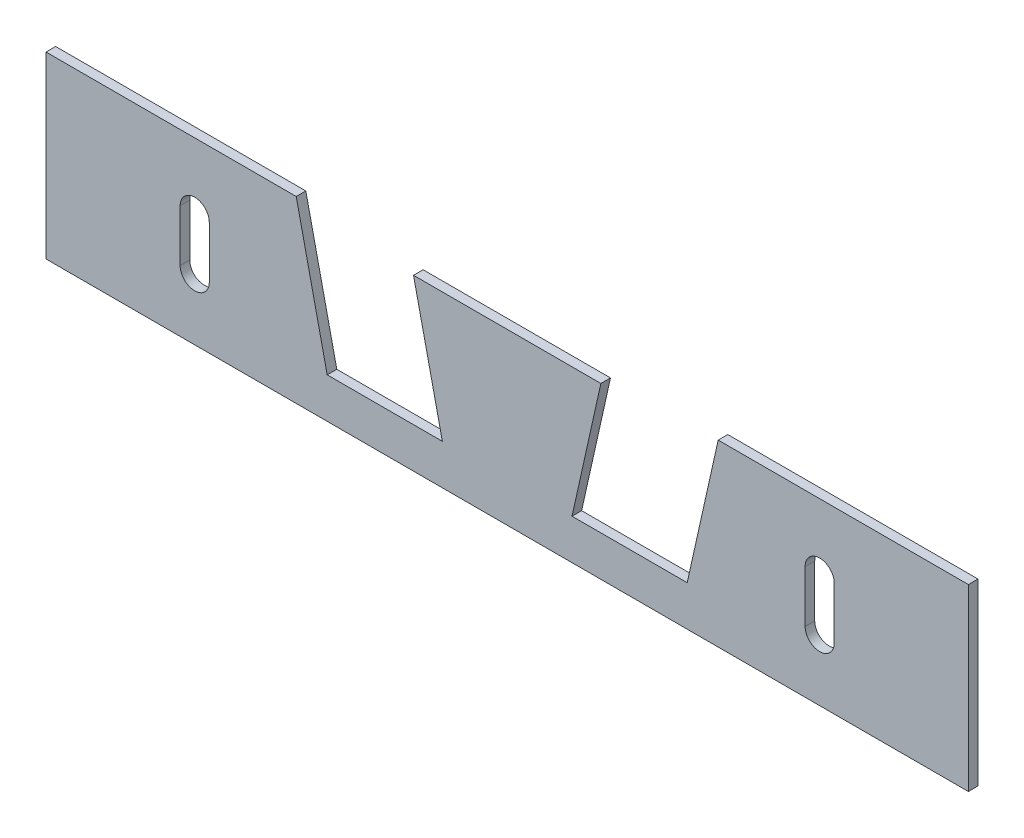
from build123d import *

# Parameters (mm, degrees)
SKETCH_1_R          = 1.5
EXTRUDE_1_DEPTH     = 1
CUT_EXTRUDE_1_DEPTH = 10
CUT_EXTRUDE_2_DEPTH = 10


with BuildPart() as part:
    # Эскиз1 → Бобышка-Вытянуть1 (new body)
    with BuildSketch(Plane.XY):
        Polygon((-16.907759352, -48.261049679), (-19.909743959, -34.796210945), (-48, -34.796210945), (-48, -53.454190801), (48, -53.454190801), (48, -34.796210945), (19.909743959, -34.796210945), (16.907759352, -48.261049679), (7.995261788, -48.261049679), (10.997246395, -34.796210945), (-10.997246395, -34.796210945), (-7.995261788, -48.261049679), align=None)
        with Locations((-32.521447951, -44.364529328)):
            Circle(SKETCH_1_R, mode=Mode.SUBTRACT)
        with Locations((32.521447951, -44.364529328)):
            Circle(SKETCH_1_R, mode=Mode.SUBTRACT)
    extrude(amount=EXTRUDE_1_DEPTH)

    # Эскиз2 → Вырез-Вытянуть1 (cut)
    with BuildSketch(Plane.XY.offset(1)):
        with BuildLine():
            Line((-34.037126116, -47.066382625), (-34.037126116, -41.662676032))
            ThreePointArc((-34.037126116, -41.662676032), (-32.521447951, -40.146997867), (-31.005769787, -41.662676032))
            Line((-31.005769787, -41.662676032), (-31.005769787, -47.066382625))
            ThreePointArc((-31.005769787, -47.066382625), (-32.521447951, -48.58206079), (-34.037126116, -47.066382625))
        make_face()
        with BuildLine():
            Line((34.037126116, -47.066382625), (34.037126116, -41.662676032))
            ThreePointArc((34.037126116, -41.662676032), (32.521447951, -40.146997867), (31.005769787, -41.662676032))
            Line((31.005769787, -41.662676032), (31.005769787, -47.066382625))
            ThreePointArc((31.005769787, -47.066382625), (32.521447951, -48.58206079), (34.037126116, -47.066382625))
        make_face()
    extrude(amount=-CUT_EXTRUDE_1_DEPTH, mode=Mode.SUBTRACT)

    # Эскиз3 → Вырез-Вытянуть2 (cut)
    with BuildSketch(Plane.XY.offset(1)):
        Polygon((-21.958847825, -34.796210945), (-18.733913306, -49.261049679), (-6.747759944, -49.261049679), (-9.749744551, -35.796210945), (9.749744551, -35.796210945), (6.747360041, -49.262843367), (18.733513403, -49.262843367), (21.958847825, -34.796210945), (19.909743959, -34.796210945), (16.907759352, -48.261049679), (7.995261788, -48.261049679), (10.997246395, -34.796210945), (-10.997246395, -34.796210945), (-7.995261788, -48.261049679), (-16.907759352, -48.261049679), (-19.909743959, -34.796210945), align=None)
    extrude(amount=-CUT_EXTRUDE_2_DEPTH, mode=Mode.SUBTRACT)


solid = part.part
